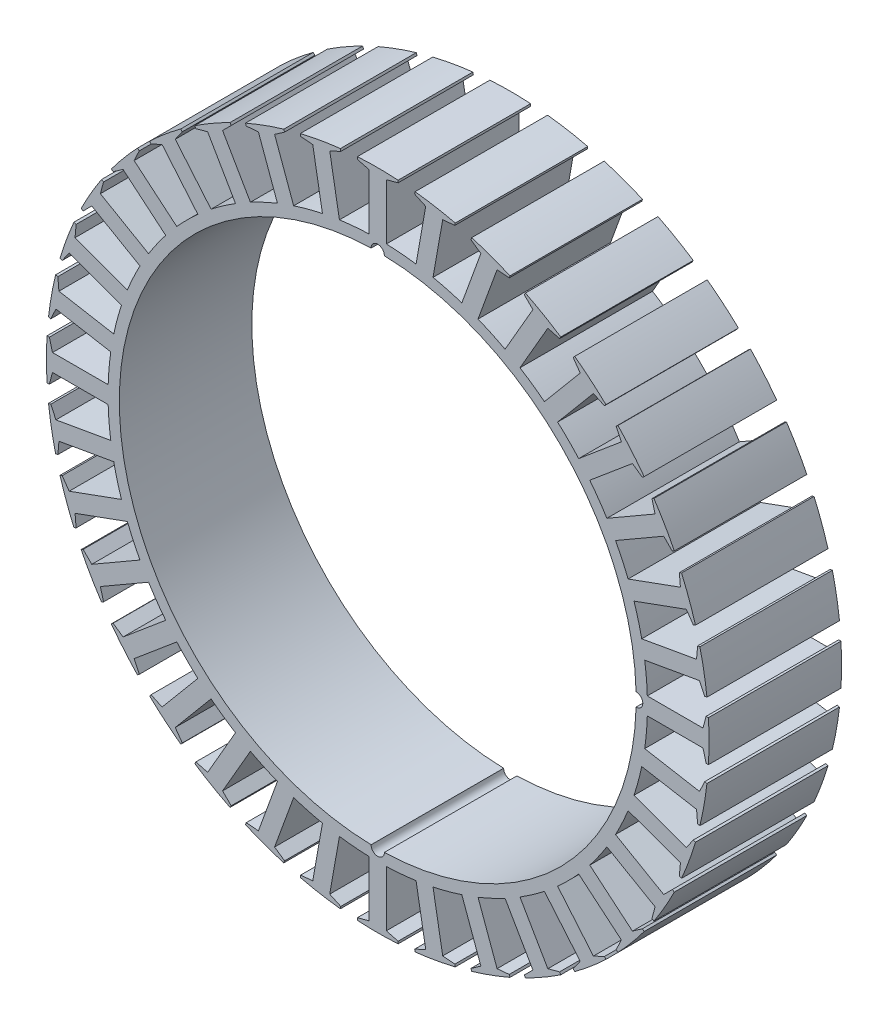
from build123d import *

# Parameters (mm, degrees)
SKETCH1_R           = 40.7
INTERNAL_RING_DEPTH = 10
STATOR_TEETH_DEPTH  = 10
TEETH_START         = -10
TEETH_PATTERN_DEPTH = 20


# Read off the part's stored shape, not the designer's step: Teeth Pattern
with BuildPart() as part:
    # Sketch1 → Internal Ring (new, symmetric)
    with BuildSketch(Plane.XY):
        Circle(SKETCH1_R)
        with BuildLine():
            ThreePointArc((-0.999917814, 38.987179487), (-39, 0), (-0.999917814, -38.987179487))
            ThreePointArc((-0.999917814, -38.987179487), (0, -40), (0.999917814, -38.987179487))
            ThreePointArc((0.999917814, -38.987179487), (27.577164466, -27.577164466), (38.987179487, -0.999917814))
            ThreePointArc((38.987179487, -0.999917814), (40, 0), (38.987179487, 0.999917814))
            ThreePointArc((38.987179487, 0.999917814), (27.577164466, 27.577164466), (0.999917814, 38.987179487))
            ThreePointArc((0.999917814, 38.987179487), (0, 40), (-0.999917814, 38.987179487))
        make_face(mode=Mode.SUBTRACT)
    extrude(amount=INTERNAL_RING_DEPTH, both=True)

    # Sketch2 → Stator Teeth (add, symmetric)
    with BuildSketch(Plane.XY):
        with BuildLine():
            Line((-3.075, 49.555354172), (-1.3, 49.083097143))
            Line((-1.3, 49.083097143), (-1.3, 40.679233031))
            ThreePointArc((-1.3, 40.679233031), (0, 40.7), (1.3, 40.679233031))
            Line((1.3, 40.679233031), (1.3, 49.083097143))
            Line((1.3, 49.083097143), (3.075, 49.555354172))
            Line((3.075, 49.555354172), (3.075, 49.905354172))
            ThreePointArc((3.075, 49.905354172), (1.538228107, 49.976332942), (0, 50))
            ThreePointArc((0, 50), (-1.538228107, 49.976332942), (-3.075, 49.905354172))
            Line((-3.075, 49.905354172), (-3.075, 49.555354172))
        make_face()
    extrude(amount=STATOR_TEETH_DEPTH, both=True)

    # Teeth Pattern outline → Teeth Pattern (add)
    with BuildSketch(Plane.XY.offset(TEETH_START)):
        with BuildLine():
            Line((-9.803440452, 48.111671977), (-8.344124764, 39.835481444))
            ThreePointArc((-8.344124764, 39.835481444), (-7.067480831, 40.081675547), (-5.783624606, 40.286966706))
            Line((-5.783624606, 40.286966706), (-7.242940294, 48.563157239))
            Line((-7.242940294, 48.563157239), (-5.576913105, 49.336465138))
            Line((-5.576913105, 49.336465138), (-5.637689967, 49.681147851))
            ThreePointArc((-5.637689967, 49.681147851), (-8.682408883, 49.240387651), (-11.694257648, 48.613211559))
            Line((-11.694257648, 48.613211559), (-11.633480786, 48.268528845))
            Line((-11.633480786, 48.268528845), (-9.803440452, 48.111671977))
        make_face()
        with BuildLine():
            Line((-18.009008327, 45.678398004), (-15.134717519, 37.781348912))
            ThreePointArc((-15.134717519, 37.781348912), (-13.920219834, 38.245489666), (-12.691516705, 38.670601285))
            Line((-12.691516705, 38.670601285), (-15.565807513, 46.567650377))
            Line((-15.565807513, 46.567650377), (-14.059374527, 47.618512576))
            Line((-14.059374527, 47.618512576), (-14.179081578, 47.947404994))
            ThreePointArc((-14.179081578, 47.947404994), (-17.101007166, 46.984631039), (-19.958191195, 45.843981112))
            Line((-19.958191195, 45.843981112), (-19.838484145, 45.515088695))
            Line((-19.838484145, 45.515088695), (-18.009008327, 45.678398004))
        make_face()
        with BuildLine():
            Line((-25.667381596, 41.857209022), (-21.46544954, 34.579249211))
            ThreePointArc((-21.46544954, 34.579249211), (-20.35, 35.247233934), (-19.213783491, 35.879249211))
            Line((-19.213783491, 35.879249211), (-23.415715547, 43.157209022))
            Line((-23.415715547, 43.157209022), (-22.114648969, 44.453695606))
            Line((-22.114648969, 44.453695606), (-22.289648969, 44.756804498))
            ThreePointArc((-22.289648969, 44.756804498), (-24.999999999, 43.301270189), (-27.615705202, 41.681804498))
            Line((-27.615705202, 41.681804498), (-27.440705202, 41.378695606))
            Line((-27.440705202, 41.378695606), (-25.667381596, 41.857209022))
        make_face()
        with BuildLine():
            Line((-32.545864465, 36.764209925), (-27.14396474, 30.326476521))
            ThreePointArc((-27.14396474, 30.326476521), (-26.161455714, 31.178008835), (-25.152249188, 31.997724306))
            Line((-25.152249188, 31.997724306), (-30.554148912, 38.43545771))
            Line((-30.554148912, 38.43545771), (-29.497980993, 39.93817559))
            Line((-29.497980993, 39.93817559), (-29.722956656, 40.206291145))
            ThreePointArc((-29.722956656, 40.206291145), (-32.139380484, 38.302222156), (-34.434129981, 36.253147345))
            Line((-34.434129981, 36.253147345), (-34.209154318, 35.98503179))
            Line((-34.209154318, 35.98503179), (-32.545864465, 36.764209925))
        make_face()
        with BuildLine():
            Line((-38.43545771, 30.554148912), (-31.997724306, 25.152249188))
            ThreePointArc((-31.997724306, 25.152249188), (-31.178008835, 26.161455714), (-30.326476521, 27.14396474))
            Line((-30.326476521, 27.14396474), (-36.764209925, 32.545864465))
            Line((-36.764209925, 32.545864465), (-35.98503179, 34.209154318))
            Line((-35.98503179, 34.209154318), (-36.253147345, 34.434129981))
            ThreePointArc((-36.253147345, 34.434129981), (-38.302222156, 32.139380484), (-40.206291145, 29.722956656))
            Line((-40.206291145, 29.722956656), (-39.93817559, 29.497980993))
            Line((-39.93817559, 29.497980993), (-38.43545771, 30.554148912))
        make_face()
        with BuildLine():
            Line((-43.157209022, 23.415715547), (-35.879249211, 19.213783491))
            ThreePointArc((-35.879249211, 19.213783491), (-35.247233934, 20.35), (-34.579249211, 21.46544954))
            Line((-34.579249211, 21.46544954), (-41.857209022, 25.667381596))
            Line((-41.857209022, 25.667381596), (-41.378695606, 27.440705202))
            Line((-41.378695606, 27.440705202), (-41.681804498, 27.615705202))
            ThreePointArc((-41.681804498, 27.615705202), (-43.301270189, 24.999999999), (-44.756804498, 22.289648969))
            Line((-44.756804498, 22.289648969), (-44.453695606, 22.114648969))
            Line((-44.453695606, 22.114648969), (-43.157209022, 23.415715547))
        make_face()
        with BuildLine():
            Line((-46.567650377, 15.565807513), (-38.670601285, 12.691516705))
            ThreePointArc((-38.670601285, 12.691516705), (-38.245489666, 13.920219834), (-37.781348912, 15.134717519))
            Line((-37.781348912, 15.134717519), (-45.678398004, 18.009008327))
            Line((-45.678398004, 18.009008327), (-45.515088695, 19.838484145))
            Line((-45.515088695, 19.838484145), (-45.843981112, 19.958191195))
            ThreePointArc((-45.843981112, 19.958191195), (-46.984631039, 17.101007166), (-47.947404994, 14.179081578))
            Line((-47.947404994, 14.179081578), (-47.618512576, 14.059374527))
            Line((-47.618512576, 14.059374527), (-46.567650377, 15.565807513))
        make_face()
        with BuildLine():
            Line((-48.563157239, 7.242940294), (-40.286966707, 5.783624606))
            ThreePointArc((-40.286966707, 5.783624606), (-40.081675547, 7.067480831), (-39.835481445, 8.344124764))
            Line((-39.835481445, 8.344124764), (-48.111671977, 9.803440452))
            Line((-48.111671977, 9.803440452), (-48.268528845, 11.633480786))
            Line((-48.268528845, 11.633480786), (-48.613211559, 11.694257648))
            ThreePointArc((-48.613211559, 11.694257648), (-49.240387651, 8.682408883), (-49.681147851, 5.637689967))
            Line((-49.681147851, 5.637689967), (-49.336465138, 5.576913105))
            Line((-49.336465138, 5.576913105), (-48.563157239, 7.242940294))
        make_face()
        with BuildLine():
            Line((-49.083097143, -1.3), (-40.679233031, -1.3))
            ThreePointArc((-40.679233031, -1.3), (-40.7, 0), (-40.679233031, 1.3))
            Line((-40.679233031, 1.3), (-49.083097143, 1.3))
            Line((-49.083097143, 1.3), (-49.555354172, 3.075))
            Line((-49.555354172, 3.075), (-49.905354172, 3.075))
            ThreePointArc((-49.905354172, 3.075), (-50, 0), (-49.905354172, -3.075))
            Line((-49.905354172, -3.075), (-49.555354172, -3.075))
            Line((-49.555354172, -3.075), (-49.083097143, -1.3))
        make_face()
        with BuildLine():
            Line((-48.111671977, -9.803440452), (-39.835481445, -8.344124764))
            ThreePointArc((-39.835481445, -8.344124764), (-40.081675548, -7.067480831), (-40.286966707, -5.783624606))
            Line((-40.286966707, -5.783624606), (-48.563157239, -7.242940294))
            Line((-48.563157239, -7.242940294), (-49.336465138, -5.576913105))
            Line((-49.336465138, -5.576913105), (-49.681147851, -5.637689967))
            ThreePointArc((-49.681147851, -5.637689967), (-49.240387651, -8.682408883), (-48.613211559, -11.694257648))
            Line((-48.613211559, -11.694257648), (-48.268528845, -11.633480786))
            Line((-48.268528845, -11.633480786), (-48.111671977, -9.803440452))
        make_face()
        with BuildLine():
            Line((-45.678398004, -18.009008327), (-37.781348912, -15.134717519))
            ThreePointArc((-37.781348912, -15.134717519), (-38.245489666, -13.920219834), (-38.670601285, -12.691516705))
            Line((-38.670601285, -12.691516705), (-46.567650377, -15.565807513))
            Line((-46.567650377, -15.565807513), (-47.618512576, -14.059374527))
            Line((-47.618512576, -14.059374527), (-47.947404994, -14.179081578))
            ThreePointArc((-47.947404994, -14.179081578), (-46.984631039, -17.101007166), (-45.843981112, -19.958191195))
            Line((-45.843981112, -19.958191195), (-45.515088695, -19.838484145))
            Line((-45.515088695, -19.838484145), (-45.678398004, -18.009008327))
        make_face()
        with BuildLine():
            Line((-41.857209022, -25.667381596), (-34.579249211, -21.46544954))
            ThreePointArc((-34.579249211, -21.46544954), (-35.247233934, -20.35), (-35.879249211, -19.213783491))
            Line((-35.879249211, -19.213783491), (-43.157209022, -23.415715547))
            Line((-43.157209022, -23.415715547), (-44.453695606, -22.114648969))
            Line((-44.453695606, -22.114648969), (-44.756804498, -22.289648969))
            ThreePointArc((-44.756804498, -22.289648969), (-43.301270189, -24.999999999), (-41.681804498, -27.615705202))
            Line((-41.681804498, -27.615705202), (-41.378695606, -27.440705202))
            Line((-41.378695606, -27.440705202), (-41.857209022, -25.667381596))
        make_face()
        with BuildLine():
            Line((-36.764209925, -32.545864465), (-30.326476521, -27.14396474))
            ThreePointArc((-30.326476521, -27.14396474), (-31.178008835, -26.161455714), (-31.997724306, -25.152249188))
            Line((-31.997724306, -25.152249188), (-38.43545771, -30.554148912))
            Line((-38.43545771, -30.554148912), (-39.93817559, -29.497980993))
            Line((-39.93817559, -29.497980993), (-40.206291145, -29.722956656))
            ThreePointArc((-40.206291145, -29.722956656), (-38.302222156, -32.139380484), (-36.253147345, -34.434129981))
            Line((-36.253147345, -34.434129981), (-35.98503179, -34.209154318))
            Line((-35.98503179, -34.209154318), (-36.764209925, -32.545864465))
        make_face()
        with BuildLine():
            Line((-30.554148912, -38.43545771), (-25.152249188, -31.997724306))
            ThreePointArc((-25.152249188, -31.997724306), (-26.161455714, -31.178008835), (-27.14396474, -30.326476521))
            Line((-27.14396474, -30.326476521), (-32.545864465, -36.764209925))
            Line((-32.545864465, -36.764209925), (-34.209154318, -35.98503179))
            Line((-34.209154318, -35.98503179), (-34.434129981, -36.253147345))
            ThreePointArc((-34.434129981, -36.253147345), (-32.139380484, -38.302222156), (-29.722956656, -40.206291145))
            Line((-29.722956656, -40.206291145), (-29.497980993, -39.93817559))
            Line((-29.497980993, -39.93817559), (-30.554148912, -38.43545771))
        make_face()
        with BuildLine():
            Line((-23.415715547, -43.157209022), (-19.213783491, -35.879249211))
            ThreePointArc((-19.213783491, -35.879249211), (-20.35, -35.247233934), (-21.46544954, -34.579249212))
            Line((-21.46544954, -34.579249212), (-25.667381596, -41.857209022))
            Line((-25.667381596, -41.857209022), (-27.440705202, -41.378695606))
            Line((-27.440705202, -41.378695606), (-27.615705202, -41.681804498))
            ThreePointArc((-27.615705202, -41.681804498), (-24.999999999, -43.301270189), (-22.289648969, -44.756804498))
            Line((-22.289648969, -44.756804498), (-22.114648969, -44.453695606))
            Line((-22.114648969, -44.453695606), (-23.415715547, -43.157209022))
        make_face()
        with BuildLine():
            Line((-15.565807513, -46.567650377), (-12.691516705, -38.670601285))
            ThreePointArc((-12.691516705, -38.670601285), (-13.920219834, -38.245489666), (-15.134717519, -37.781348912))
            Line((-15.134717519, -37.781348912), (-18.009008327, -45.678398004))
            Line((-18.009008327, -45.678398004), (-19.838484145, -45.515088695))
            Line((-19.838484145, -45.515088695), (-19.958191195, -45.843981112))
            ThreePointArc((-19.958191195, -45.843981112), (-17.101007166, -46.984631039), (-14.179081578, -47.947404994))
            Line((-14.179081578, -47.947404994), (-14.059374527, -47.618512576))
            Line((-14.059374527, -47.618512576), (-15.565807513, -46.567650377))
        make_face()
        with BuildLine():
            Line((-7.242940294, -48.563157239), (-5.783624606, -40.286966707))
            ThreePointArc((-5.783624606, -40.286966707), (-7.067480831, -40.081675548), (-8.344124764, -39.835481445))
            Line((-8.344124764, -39.835481445), (-9.803440452, -48.111671977))
            Line((-9.803440452, -48.111671977), (-11.633480786, -48.268528845))
            Line((-11.633480786, -48.268528845), (-11.694257648, -48.613211559))
            ThreePointArc((-11.694257648, -48.613211559), (-8.682408883, -49.240387651), (-5.637689967, -49.681147851))
            Line((-5.637689967, -49.681147851), (-5.576913105, -49.336465138))
            Line((-5.576913105, -49.336465138), (-7.242940294, -48.563157239))
        make_face()
        with BuildLine():
            ThreePointArc((5.783624606, 40.286966706), (7.067480831, 40.081675547), (8.344124764, 39.835481444))
            Line((8.344124764, 39.835481444), (9.803440452, 48.111671977))
            Line((9.803440452, 48.111671977), (11.633480786, 48.268528845))
            Line((11.633480786, 48.268528845), (11.694257648, 48.613211559))
            ThreePointArc((11.694257648, 48.613211559), (8.682408883, 49.240387651), (5.637689967, 49.681147851))
            Line((5.637689967, 49.681147851), (5.576913105, 49.336465138))
            Line((5.576913105, 49.336465138), (7.242940294, 48.563157239))
            Line((7.242940294, 48.563157239), (5.783624606, 40.286966706))
        make_face()
        with BuildLine():
            ThreePointArc((12.691516705, 38.670601285), (13.920219834, 38.245489666), (15.134717519, 37.781348912))
            Line((15.134717519, 37.781348912), (18.009008327, 45.678398004))
            Line((18.009008327, 45.678398004), (19.838484145, 45.515088695))
            Line((19.838484145, 45.515088695), (19.958191195, 45.843981112))
            ThreePointArc((19.958191195, 45.843981112), (17.101007166, 46.984631039), (14.179081578, 47.947404994))
            Line((14.179081578, 47.947404994), (14.059374527, 47.618512576))
            Line((14.059374527, 47.618512576), (15.565807513, 46.567650377))
            Line((15.565807513, 46.567650377), (12.691516705, 38.670601285))
        make_face()
        with BuildLine():
            ThreePointArc((19.213783491, 35.879249211), (20.35, 35.247233934), (21.46544954, 34.579249211))
            Line((21.46544954, 34.579249211), (25.667381596, 41.857209022))
            Line((25.667381596, 41.857209022), (27.440705202, 41.378695606))
            Line((27.440705202, 41.378695606), (27.615705202, 41.681804498))
            ThreePointArc((27.615705202, 41.681804498), (24.999999999, 43.301270189), (22.289648969, 44.756804498))
            Line((22.289648969, 44.756804498), (22.114648969, 44.453695606))
            Line((22.114648969, 44.453695606), (23.415715547, 43.157209022))
            Line((23.415715547, 43.157209022), (19.213783491, 35.879249211))
        make_face()
        with BuildLine():
            ThreePointArc((25.152249188, 31.997724306), (26.161455714, 31.178008835), (27.14396474, 30.326476521))
            Line((27.14396474, 30.326476521), (32.545864465, 36.764209925))
            Line((32.545864465, 36.764209925), (34.209154318, 35.98503179))
            Line((34.209154318, 35.98503179), (34.434129981, 36.253147345))
            ThreePointArc((34.434129981, 36.253147345), (32.139380484, 38.302222156), (29.722956656, 40.206291145))
            Line((29.722956656, 40.206291145), (29.497980993, 39.93817559))
            Line((29.497980993, 39.93817559), (30.554148912, 38.43545771))
            Line((30.554148912, 38.43545771), (25.152249188, 31.997724306))
        make_face()
        with BuildLine():
            ThreePointArc((30.326476521, 27.14396474), (31.178008835, 26.161455714), (31.997724306, 25.152249188))
            Line((31.997724306, 25.152249188), (38.43545771, 30.554148912))
            Line((38.43545771, 30.554148912), (39.93817559, 29.497980993))
            Line((39.93817559, 29.497980993), (40.206291145, 29.722956656))
            ThreePointArc((40.206291145, 29.722956656), (38.302222156, 32.139380484), (36.253147345, 34.434129981))
            Line((36.253147345, 34.434129981), (35.98503179, 34.209154318))
            Line((35.98503179, 34.209154318), (36.764209925, 32.545864465))
            Line((36.764209925, 32.545864465), (30.326476521, 27.14396474))
        make_face()
        with BuildLine():
            ThreePointArc((34.579249211, 21.46544954), (35.247233934, 20.35), (35.879249211, 19.213783491))
            Line((35.879249211, 19.213783491), (43.157209022, 23.415715547))
            Line((43.157209022, 23.415715547), (44.453695606, 22.114648969))
            Line((44.453695606, 22.114648969), (44.756804498, 22.289648969))
            ThreePointArc((44.756804498, 22.289648969), (43.301270189, 24.999999999), (41.681804498, 27.615705202))
            Line((41.681804498, 27.615705202), (41.378695606, 27.440705202))
            Line((41.378695606, 27.440705202), (41.857209022, 25.667381596))
            Line((41.857209022, 25.667381596), (34.579249211, 21.46544954))
        make_face()
        with BuildLine():
            ThreePointArc((37.781348912, 15.134717519), (38.245489666, 13.920219834), (38.670601285, 12.691516705))
            Line((38.670601285, 12.691516705), (46.567650377, 15.565807513))
            Line((46.567650377, 15.565807513), (47.618512576, 14.059374527))
            Line((47.618512576, 14.059374527), (47.947404994, 14.179081578))
            ThreePointArc((47.947404994, 14.179081578), (46.984631039, 17.101007166), (45.843981112, 19.958191195))
            Line((45.843981112, 19.958191195), (45.515088695, 19.838484145))
            Line((45.515088695, 19.838484145), (45.678398004, 18.009008327))
            Line((45.678398004, 18.009008327), (37.781348912, 15.134717519))
        make_face()
        with BuildLine():
            ThreePointArc((39.835481445, 8.344124764), (40.081675547, 7.067480831), (40.286966707, 5.783624606))
            Line((40.286966707, 5.783624606), (48.563157239, 7.242940294))
            Line((48.563157239, 7.242940294), (49.336465138, 5.576913105))
            Line((49.336465138, 5.576913105), (49.681147851, 5.637689967))
            ThreePointArc((49.681147851, 5.637689967), (49.240387651, 8.682408883), (48.613211559, 11.694257648))
            Line((48.613211559, 11.694257648), (48.268528845, 11.633480786))
            Line((48.268528845, 11.633480786), (48.111671977, 9.803440452))
            Line((48.111671977, 9.803440452), (39.835481445, 8.344124764))
        make_face()
        with BuildLine():
            ThreePointArc((40.679233031, 1.3), (40.7, 0), (40.679233031, -1.3))
            Line((40.679233031, -1.3), (49.083097143, -1.3))
            Line((49.083097143, -1.3), (49.555354172, -3.075))
            Line((49.555354172, -3.075), (49.905354172, -3.075))
            ThreePointArc((49.905354172, -3.075), (50, 0), (49.905354172, 3.075))
            Line((49.905354172, 3.075), (49.555354172, 3.075))
            Line((49.555354172, 3.075), (49.083097143, 1.3))
            Line((49.083097143, 1.3), (40.679233031, 1.3))
        make_face()
        with BuildLine():
            ThreePointArc((40.286966707, -5.783624606), (40.081675548, -7.067480831), (39.835481445, -8.344124764))
            Line((39.835481445, -8.344124764), (48.111671977, -9.803440452))
            Line((48.111671977, -9.803440452), (48.268528845, -11.633480786))
            Line((48.268528845, -11.633480786), (48.613211559, -11.694257648))
            ThreePointArc((48.613211559, -11.694257648), (49.240387651, -8.682408883), (49.681147851, -5.637689967))
            Line((49.681147851, -5.637689967), (49.336465138, -5.576913105))
            Line((49.336465138, -5.576913105), (48.563157239, -7.242940294))
            Line((48.563157239, -7.242940294), (40.286966707, -5.783624606))
        make_face()
        with BuildLine():
            ThreePointArc((38.670601285, -12.691516705), (38.245489666, -13.920219834), (37.781348912, -15.134717519))
            Line((37.781348912, -15.134717519), (45.678398004, -18.009008327))
            Line((45.678398004, -18.009008327), (45.515088695, -19.838484145))
            Line((45.515088695, -19.838484145), (45.843981112, -19.958191195))
            ThreePointArc((45.843981112, -19.958191195), (46.984631039, -17.101007166), (47.947404994, -14.179081578))
            Line((47.947404994, -14.179081578), (47.618512576, -14.059374527))
            Line((47.618512576, -14.059374527), (46.567650377, -15.565807513))
            Line((46.567650377, -15.565807513), (38.670601285, -12.691516705))
        make_face()
        with BuildLine():
            ThreePointArc((35.879249211, -19.213783491), (35.247233934, -20.35), (34.579249211, -21.46544954))
            Line((34.579249211, -21.46544954), (41.857209022, -25.667381596))
            Line((41.857209022, -25.667381596), (41.378695606, -27.440705202))
            Line((41.378695606, -27.440705202), (41.681804498, -27.615705202))
            ThreePointArc((41.681804498, -27.615705202), (43.301270189, -24.999999999), (44.756804498, -22.289648969))
            Line((44.756804498, -22.289648969), (44.453695606, -22.114648969))
            Line((44.453695606, -22.114648969), (43.157209022, -23.415715547))
            Line((43.157209022, -23.415715547), (35.879249211, -19.213783491))
        make_face()
        with BuildLine():
            ThreePointArc((31.997724306, -25.152249188), (31.178008835, -26.161455714), (30.326476521, -27.14396474))
            Line((30.326476521, -27.14396474), (36.764209925, -32.545864465))
            Line((36.764209925, -32.545864465), (35.98503179, -34.209154318))
            Line((35.98503179, -34.209154318), (36.253147345, -34.434129981))
            ThreePointArc((36.253147345, -34.434129981), (38.302222156, -32.139380484), (40.206291145, -29.722956656))
            Line((40.206291145, -29.722956656), (39.93817559, -29.497980993))
            Line((39.93817559, -29.497980993), (38.43545771, -30.554148912))
            Line((38.43545771, -30.554148912), (31.997724306, -25.152249188))
        make_face()
        with BuildLine():
            ThreePointArc((27.14396474, -30.326476521), (26.161455714, -31.178008835), (25.152249188, -31.997724306))
            Line((25.152249188, -31.997724306), (30.554148912, -38.43545771))
            Line((30.554148912, -38.43545771), (29.497980993, -39.93817559))
            Line((29.497980993, -39.93817559), (29.722956656, -40.206291145))
            ThreePointArc((29.722956656, -40.206291145), (32.139380484, -38.302222156), (34.434129981, -36.253147345))
            Line((34.434129981, -36.253147345), (34.209154318, -35.98503179))
            Line((34.209154318, -35.98503179), (32.545864465, -36.764209925))
            Line((32.545864465, -36.764209925), (27.14396474, -30.326476521))
        make_face()
        with BuildLine():
            ThreePointArc((21.46544954, -34.579249212), (20.35, -35.247233934), (19.213783491, -35.879249211))
            Line((19.213783491, -35.879249211), (23.415715547, -43.157209022))
            Line((23.415715547, -43.157209022), (22.114648969, -44.453695606))
            Line((22.114648969, -44.453695606), (22.289648969, -44.756804498))
            ThreePointArc((22.289648969, -44.756804498), (24.999999999, -43.301270189), (27.615705202, -41.681804498))
            Line((27.615705202, -41.681804498), (27.440705202, -41.378695606))
            Line((27.440705202, -41.378695606), (25.667381596, -41.857209022))
            Line((25.667381596, -41.857209022), (21.46544954, -34.579249212))
        make_face()
        with BuildLine():
            ThreePointArc((15.134717519, -37.781348912), (13.920219834, -38.245489666), (12.691516705, -38.670601285))
            Line((12.691516705, -38.670601285), (15.565807513, -46.567650377))
            Line((15.565807513, -46.567650377), (14.059374527, -47.618512576))
            Line((14.059374527, -47.618512576), (14.179081578, -47.947404994))
            ThreePointArc((14.179081578, -47.947404994), (17.101007166, -46.984631039), (19.958191195, -45.843981112))
            Line((19.958191195, -45.843981112), (19.838484145, -45.515088695))
            Line((19.838484145, -45.515088695), (18.009008327, -45.678398004))
            Line((18.009008327, -45.678398004), (15.134717519, -37.781348912))
        make_face()
        with BuildLine():
            ThreePointArc((8.344124764, -39.835481445), (7.067480831, -40.081675548), (5.783624606, -40.286966707))
            Line((5.783624606, -40.286966707), (7.242940294, -48.563157239))
            Line((7.242940294, -48.563157239), (5.576913105, -49.336465138))
            Line((5.576913105, -49.336465138), (5.637689967, -49.681147851))
            ThreePointArc((5.637689967, -49.681147851), (8.682408883, -49.240387651), (11.694257648, -48.613211559))
            Line((11.694257648, -48.613211559), (11.633480786, -48.268528845))
            Line((11.633480786, -48.268528845), (9.803440452, -48.111671977))
            Line((9.803440452, -48.111671977), (8.344124764, -39.835481445))
        make_face()
        with BuildLine():
            Line((1.3, -49.083097143), (1.3, -40.679233031))
            ThreePointArc((1.3, -40.679233031), (0, -40.7), (-1.3, -40.679233031))
            Line((-1.3, -40.679233031), (-1.3, -49.083097143))
            Line((-1.3, -49.083097143), (-3.075, -49.555354172))
            Line((-3.075, -49.555354172), (-3.075, -49.905354172))
            ThreePointArc((-3.075, -49.905354172), (0, -50), (3.075, -49.905354172))
            Line((3.075, -49.905354172), (3.075, -49.555354172))
            Line((3.075, -49.555354172), (1.3, -49.083097143))
        make_face()
    extrude(amount=TEETH_PATTERN_DEPTH)


solid = part.part
